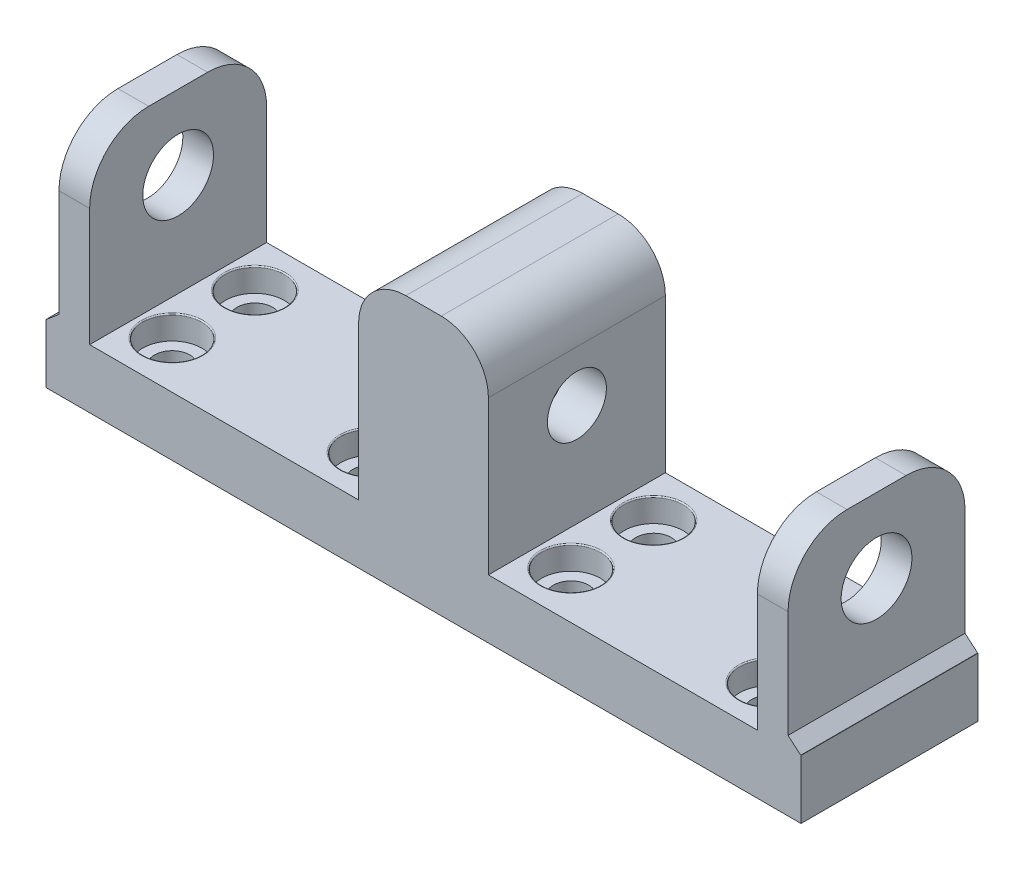
from build123d import *

# Parameters (mm, degrees)
SALIENTE_EXTRUIR1_DEPTH = 15
CROQUIS2_R              = 2.5
CORTAR_EXTRUIR1_DEPTH   = 3.5
CORTAR_EXTRUIR2_START   = -3.5
CROQUIS3_R              = 2.5
CORTAR_EXTRUIR2_DEPTH   = 3.5
CROQUIS4_R              = 2.5
CORTAR_EXTRUIR3_DEPTH   = 2
REDONDEO1_R             = 0.1
CROQUIS5_R              = 1.5
CORTAR_EXTRUIR4_DEPTH   = 26.421447638
CROQUIS6_W              = 15
CROQUIS6_H              = 5
SALIENTE_EXTRUIR2_DEPTH = 20.5
CROQUIS7_W              = 15
CROQUIS7_H              = 5
SALIENTE_EXTRUIR3_DEPTH = 20.5
CROQUIS8_W              = 2.6
CROQUIS8_H              = 15
SALIENTE_EXTRUIR4_DEPTH = 15
REDONDEO4_R             = 5
REDONDEO5_R             = 5
NERVIO1_REACH           = 36.659
CROQUIS17_WALL_W        = 72.729848992
CROQUIS17_WALL_H        = 15
NERVIO2_REACH           = 36.659
CROQUIS22_WALL_W        = 72.745779448
CROQUIS22_WALL_H        = 15
CROQUIS23_R             = 3
CORTAR_EXTRUIR5_DEPTH   = 7
CORTAR_EXTRUIR6_START   = -7
CROQUIS24_R             = 3
CORTAR_EXTRUIR6_DEPTH   = 7
CROQUIS27_R             = 1.5
CORTAR_EXTRUIR8_DEPTH   = 40.217343102
CROQUIS29_R             = 2.5
CORTAR_EXTRUIR9_DEPTH   = 2
REDONDEO6_R             = 0.1
CROQUIS30_R             = 1.5
CORTAR_EXTRUIR10_DEPTH  = 40.217343102
CROQUIS32_R             = 2.5
CORTAR_EXTRUIR11_DEPTH  = 2
REDONDEO7_R             = 0.1


with BuildPart() as part:
    # Croquis1 → Saliente-Extruir1 (new body)
    with BuildSketch(Plane.XY):
        with BuildLine():
            Line((-1.5, 11), (1.5, 11))
            ThreePointArc((1.5, 11), (4.328427125, 9.828427125), (5.5, 7))
            Line((5.5, 7), (5.5, -6))
            Line((5.5, -6), (11.5, -6))
            Line((11.5, -6), (11.5, -11))
            Line((11.5, -11), (5.5, -11))
            Line((5.5, -11), (-5.5, -11))
            Line((-5.5, -11), (-11.5, -11))
            Line((-11.5, -11), (-11.5, -6))
            Line((-11.5, -6), (-5.5, -6))
            Line((-5.5, -6), (-5.5, 7))
            ThreePointArc((-5.5, 7), (-4.328427125, 9.828427125), (-1.5, 11))
        make_face()
    extrude(amount=-SALIENTE_EXTRUIR1_DEPTH)

    # Croquis2 → Cortar-Extruir1 (cut)
    with BuildSketch(Plane(origin=(5.5, 0, 0), x_dir=(0, 0, -1), z_dir=(1, 0, 0))):
        with Locations((7.5, 2.7)):
            Circle(CROQUIS2_R)
    extrude(amount=-CORTAR_EXTRUIR1_DEPTH, mode=Mode.SUBTRACT)

    # Croquis3 → Cortar-Extruir2 (cut)
    with BuildSketch(Plane.ZY.offset(5.5).offset(CORTAR_EXTRUIR2_START)):
        with Locations((-7.5, 2.7)):
            Circle(CROQUIS3_R)
    extrude(amount=CORTAR_EXTRUIR2_DEPTH, mode=Mode.SUBTRACT)

    # Croquis4 → Cortar-Extruir3 (cut)
    with BuildSketch(Plane(origin=(0, -6, 0), x_dir=(1, 0, 0), z_dir=(0, 1, 0))):
        with Locations((-8.5, 11)):
            Circle(CROQUIS4_R)
        with Locations((-8.5, 4)):
            Circle(CROQUIS4_R)
        with Locations((8.5, 4)):
            Circle(CROQUIS4_R)
        with Locations((8.5, 11)):
            Circle(CROQUIS4_R)
    extrude(amount=-CORTAR_EXTRUIR3_DEPTH, mode=Mode.SUBTRACT)

    # Redondeo1
    redondeo1_edges = [part.edges().sort_by_distance(p)[0] for p in [
        (6, -6, -4),
        (6, -6, -11),
        (-11, -6, -4),
        (-11, -6, -11),
    ]]
    fillet(redondeo1_edges, radius=REDONDEO1_R)

    # Croquis5 → Cortar-Extruir4 (cut, through all)
    with BuildSketch(Plane(origin=(0, -6, 0), x_dir=(1, 0, 0), z_dir=(0, 1, 0))):
        with Locations((-8.5, 11)):
            Circle(CROQUIS5_R)
        with Locations((-8.5, 4)):
            Circle(CROQUIS5_R)
        with Locations((8.5, 4)):
            Circle(CROQUIS5_R)
        with Locations((8.5, 11)):
            Circle(CROQUIS5_R)
    extrude(amount=-CORTAR_EXTRUIR4_DEPTH, mode=Mode.SUBTRACT)

    # Croquis6 → Saliente-Extruir2 (add)
    with BuildSketch(Plane.ZY.offset(11.5)):
        with Locations((-7.5, -8.5)):
            Rectangle(CROQUIS6_W, CROQUIS6_H)
    extrude(amount=SALIENTE_EXTRUIR2_DEPTH)

    # Croquis7 → Saliente-Extruir3 (add)
    with BuildSketch(Plane(origin=(11.5, 0, 0), x_dir=(0, 0, -1), z_dir=(1, 0, 0))):
        with Locations((7.5, -8.5)):
            Rectangle(CROQUIS7_W, CROQUIS7_H)
    extrude(amount=SALIENTE_EXTRUIR3_DEPTH)

    # Croquis8 → Saliente-Extruir4 (add)
    with BuildSketch(Plane(origin=(0, -6, 0), x_dir=(1, 0, 0), z_dir=(0, 1, 0))):
        with Locations((-29.6, 7.5)):
            Rectangle(CROQUIS8_W, CROQUIS8_H)
        with Locations((29.6, 7.5)):
            Rectangle(CROQUIS8_W, CROQUIS8_H)
    extrude(amount=SALIENTE_EXTRUIR4_DEPTH)

    # Redondeo4
    redondeo4_edges = [part.edges().sort_by_distance(p)[0] for p in [
        (-29.6, 9, -15),
        (-29.6, 9, 0),
    ]]
    fillet(redondeo4_edges, radius=REDONDEO4_R)

    # Redondeo5
    redondeo5_edges = [part.edges().sort_by_distance(p)[0] for p in [
        (29.6, 9, -15),
        (29.6, 9, 0),
    ]]
    fillet(redondeo5_edges, radius=REDONDEO5_R)

    # Croquis17 wall → Nervio1 (add, up to next)
    with BuildSketch(Plane(origin=(31.436186969, -5.540917019, -7.5), x_dir=(0.759610590748, -0.650378159553, 0), z_dir=(0.650378159553, 0.759610590748, 0)), mode=Mode.PRIVATE) as nervio1_sk1:
        Rectangle(CROQUIS17_WALL_W, CROQUIS17_WALL_H)
    nervio1_tool1 = extrude(nervio1_sk1.sketch, amount=-NERVIO1_REACH, mode=Mode.PRIVATE) - part.part
    add(nervio1_tool1.solids().sort_by_distance((31.436186969, -5.540917019, -7.5))[0])

    # Croquis22 wall → Nervio2 (add, up to next)
    with BuildSketch(Plane(origin=(-31.446630364, -5.540917019, -7.5), x_dir=(0.765764557324, 0.643121017186, 0), z_dir=(-0.643121017186, 0.765764557324, 0)), mode=Mode.PRIVATE) as nervio2_sk1:
        Rectangle(CROQUIS22_WALL_W, CROQUIS22_WALL_H)
    nervio2_tool1 = extrude(nervio2_sk1.sketch, amount=-NERVIO2_REACH, mode=Mode.PRIVATE) - part.part
    add(nervio2_tool1.solids().sort_by_distance((-31.446630364, -5.540917019, -7.5))[0])

    # Croquis23 → Cortar-Extruir5 (cut)
    with BuildSketch(Plane(origin=(30.9, 0, 0), x_dir=(0, 0, -1), z_dir=(1, 0, 0))):
        with Locations((7.5, 2.7)):
            Circle(CROQUIS23_R)
    extrude(amount=-CORTAR_EXTRUIR5_DEPTH, mode=Mode.SUBTRACT)

    # Croquis24 → Cortar-Extruir6 (cut)
    with BuildSketch(Plane.ZY.offset(30.9).offset(CORTAR_EXTRUIR6_START)):
        with Locations((-7.5, 2.7)):
            Circle(CROQUIS24_R)
    extrude(amount=CORTAR_EXTRUIR6_DEPTH, mode=Mode.SUBTRACT)

    # Croquis27 → Cortar-Extruir8 (cut, through all)
    with BuildSketch(Plane(origin=(0, -6, 0), x_dir=(1, 0, 0), z_dir=(0, 1, 0))):
        with Locations((-25.3, 11)):
            Circle(CROQUIS27_R)
        with Locations((-25.3, 4)):
            Circle(CROQUIS27_R)
    extrude(amount=-CORTAR_EXTRUIR8_DEPTH, mode=Mode.SUBTRACT)

    # Croquis29 → Cortar-Extruir9 (cut)
    with BuildSketch(Plane(origin=(0, -6, 0), x_dir=(1, 0, 0), z_dir=(0, 1, 0))):
        with Locations((-25.3, 11)):
            Circle(CROQUIS29_R)
        with Locations((-25.3, 4)):
            Circle(CROQUIS29_R)
    extrude(amount=-CORTAR_EXTRUIR9_DEPTH, mode=Mode.SUBTRACT)

    # Redondeo6
    redondeo6_edges = [part.edges().sort_by_distance(p)[0] for p in [
        (-27.8, -6, -4),
        (-27.8, -6, -11),
    ]]
    fillet(redondeo6_edges, radius=REDONDEO6_R)

    # Croquis30 → Cortar-Extruir10 (cut, through all)
    with BuildSketch(Plane(origin=(0, -6, 0), x_dir=(1, 0, 0), z_dir=(0, 1, 0))):
        with Locations((25.3, 11)):
            Circle(CROQUIS30_R)
        with Locations((25.3, 4)):
            Circle(CROQUIS30_R)
    extrude(amount=-CORTAR_EXTRUIR10_DEPTH, mode=Mode.SUBTRACT)

    # Croquis32 → Cortar-Extruir11 (cut)
    with BuildSketch(Plane(origin=(0, -6, 0), x_dir=(1, 0, 0), z_dir=(0, 1, 0))):
        with Locations((25.3, 11)):
            Circle(CROQUIS32_R)
        with Locations((25.3, 4)):
            Circle(CROQUIS32_R)
    extrude(amount=-CORTAR_EXTRUIR11_DEPTH, mode=Mode.SUBTRACT)

    # Redondeo7
    redondeo7_edges = [part.edges().sort_by_distance(p)[0] for p in [
        (22.8, -6, -4),
        (22.8, -6, -11),
    ]]
    fillet(redondeo7_edges, radius=REDONDEO7_R)


solid = part.part
